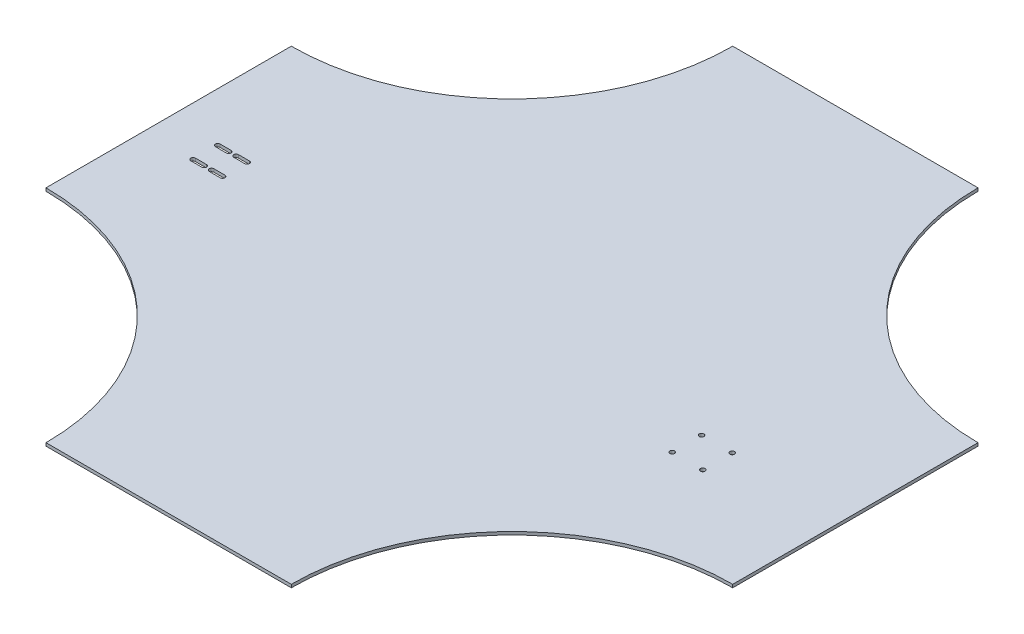
from build123d import *

# Parameters (mm, degrees)
BOSS_EXTRUDE1_DEPTH     = 3.175
CUT_EXTRUDE1_DEPTH      = 503.904365287
CUT_EXTRUDE1_DEPTH_BACK = 503.904365287
SKETCH4_R               = 2.413
CUT_EXTRUDE2_DEPTH      = 503.904365287


with BuildPart() as part:
    # Sketch1 → Boss-Extrude1 (new body)
    with BuildSketch(Plane(origin=(0, 0, 0), x_dir=(1, 0, 0), z_dir=(0, 1, 0))):
        with BuildLine():
            Line((-127, -355.6), (127, -355.6))
            ThreePointArc((127, -355.6), (193.955389821, -193.955389821), (355.6, -127))
            Line((355.6, -127), (355.6, 127))
            ThreePointArc((355.6, 127), (193.955389821, 193.955389821), (127, 355.6))
            Line((127, 355.6), (-127, 355.6))
            ThreePointArc((-127, 355.6), (-193.955389821, 193.955389821), (-355.6, 127))
            Line((-355.6, 127), (-355.6, -127))
            ThreePointArc((-355.6, -127), (-193.955389821, -193.955389821), (-127, -355.6))
        make_face()
    extrude(amount=BOSS_EXTRUDE1_DEPTH)

    # Sketch2 → Cut-Extrude1 (cut, two sides: drawn at the far end of the back side and taken through both)
    with BuildSketch(Plane(origin=(0, 3.175, 0), x_dir=(1, 0, 0), z_dir=(0, 1, 0)).offset(-CUT_EXTRUDE1_DEPTH_BACK)):
        with BuildLine():
            Line((-304.8, 2.413), (-293.37, 2.413))
            ThreePointArc((-293.37, 2.413), (-290.957, 0), (-293.37, -2.413))
            Line((-293.37, -2.413), (-304.8, -2.413))
            ThreePointArc((-304.8, -2.413), (-307.213, 0), (-304.8, 2.413))
        make_face()
        with BuildLine():
            Line((-304.8, -22.987), (-293.37, -22.987))
            ThreePointArc((-293.37, -22.987), (-290.957, -25.4), (-293.37, -27.813))
            Line((-293.37, -27.813), (-304.8, -27.813))
            ThreePointArc((-304.8, -27.813), (-307.213, -25.4), (-304.8, -22.987))
        make_face()
        with BuildLine():
            Line((-285.75, -2.413), (-274.32, -2.413))
            ThreePointArc((-274.32, -2.413), (-271.907, 0), (-274.32, 2.413))
            Line((-274.32, 2.413), (-285.75, 2.413))
            ThreePointArc((-285.75, 2.413), (-288.163, 0), (-285.75, -2.413))
        make_face()
        with BuildLine():
            Line((-285.75, -22.987), (-274.32, -22.987))
            ThreePointArc((-274.32, -22.987), (-271.907, -25.4), (-274.32, -27.813))
            Line((-274.32, -27.813), (-285.75, -27.813))
            ThreePointArc((-285.75, -27.813), (-288.163, -25.4), (-285.75, -22.987))
        make_face()
    extrude(amount=CUT_EXTRUDE1_DEPTH + CUT_EXTRUDE1_DEPTH_BACK, mode=Mode.SUBTRACT)

    # Sketch4 → Cut-Extrude2 (cut, through all)
    with BuildSketch(Plane(origin=(0, 3.175, 0), x_dir=(1, 0, 0), z_dir=(0, 1, 0))):
        with Locations((237.49, -9.430177049)):
            Circle(SKETCH4_R)
        with Locations((205.74, -9.430177049)):
            Circle(SKETCH4_R)
        with Locations((237.49, -39.910177049)):
            Circle(SKETCH4_R)
        with Locations((205.74, -39.910177049)):
            Circle(SKETCH4_R)
    extrude(amount=-CUT_EXTRUDE2_DEPTH, mode=Mode.SUBTRACT)


solid = part.part
